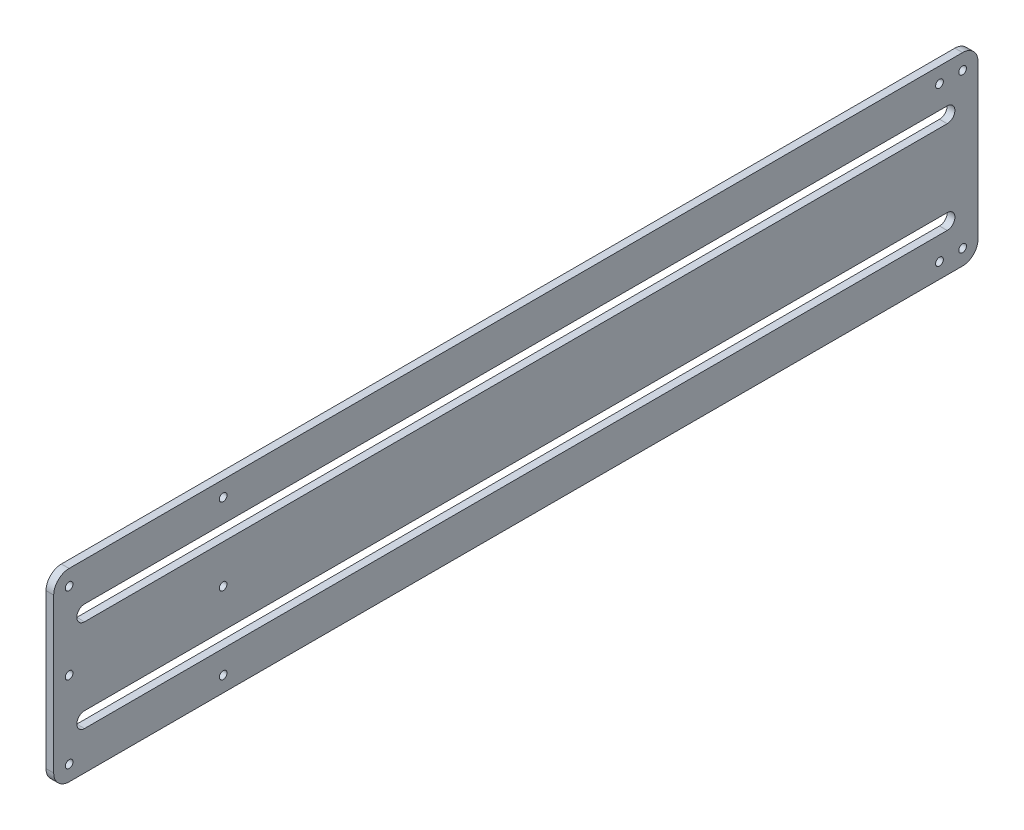
from build123d import *

# Parameters (mm, degrees)
OUTER_CUT_DEPTH    = 1.5875
SLOTS_DEPTH        = 195.298586266
SKETCH3_R          = 1.5875
MOUNT_HOLES_DEPTH  = 195.298586266
SKETCH4_R          = 1.5875
CUT_EXTRUDE1_DEPTH = 195.298586266


with BuildPart() as part:
    # Sketch1 → Outer Cut (new, symmetric)
    with BuildSketch(Plane(origin=(0, 0, 0), x_dir=(0, 0, -1), z_dir=(1, 0, 0))):
        with BuildLine():
            Line((-184.15, -38.1), (184.15, -38.1))
            ThreePointArc((184.15, -38.1), (188.640128061, -36.240128061), (190.5, -31.75))
            Line((190.5, -31.75), (190.5, 31.75))
            ThreePointArc((190.5, 31.75), (188.640128061, 36.240128061), (184.15, 38.1))
            Line((184.15, 38.1), (-184.15, 38.1))
            ThreePointArc((-184.15, 38.1), (-188.640128061, 36.240128061), (-190.5, 31.75))
            Line((-190.5, 31.75), (-190.5, -31.75))
            ThreePointArc((-190.5, -31.75), (-188.640128061, -36.240128061), (-184.15, -38.1))
        make_face()
    extrude(amount=OUTER_CUT_DEPTH, both=True)

    # Sketch2 → Slots (cut, through all)
    with BuildSketch(Plane(origin=(1.5875, 0, 0), x_dir=(0, 0, -1), z_dir=(1, 0, 0))):
        with BuildLine():
            Line((-177.8, 22.225), (177.8, 22.225))
            ThreePointArc((177.8, 22.225), (180.975, 19.05), (177.8, 15.875))
            Line((177.8, 15.875), (-177.8, 15.875))
            ThreePointArc((-177.8, 15.875), (-180.975, 19.05), (-177.8, 22.225))
        make_face()
        with BuildLine():
            Line((-177.8, -22.225), (177.8, -22.225))
            ThreePointArc((177.8, -22.225), (180.975, -19.05), (177.8, -15.875))
            Line((177.8, -15.875), (-177.8, -15.875))
            ThreePointArc((-177.8, -15.875), (-180.975, -19.05), (-177.8, -22.225))
        make_face()
    extrude(amount=-SLOTS_DEPTH, mode=Mode.SUBTRACT)

    # Sketch3 → Mount Holes (cut, through all)
    with BuildSketch(Plane(origin=(1.5875, 0, 0), x_dir=(0, 0, -1), z_dir=(1, 0, 0))):
        with Locations((-184.15, 31.75)):
            Circle(SKETCH3_R)
        with Locations((-120.65, 31.75)):
            Circle(SKETCH3_R)
        with Locations((-120.65, -31.75)):
            Circle(SKETCH3_R)
        with Locations((-184.15, -31.75)):
            Circle(SKETCH3_R)
        with Locations((-184.15, 0)):
            Circle(SKETCH3_R)
        with Locations((-120.65, 0)):
            Circle(SKETCH3_R)
    extrude(amount=-MOUNT_HOLES_DEPTH, mode=Mode.SUBTRACT)

    # Sketch4 → Cut-Extrude1 (cut, through all)
    with BuildSketch(Plane(origin=(1.5875, 0, 0), x_dir=(0, 0, -1), z_dir=(1, 0, 0))):
        with Locations((184.15, 31.75)):
            Circle(SKETCH4_R)
        with Locations((174.625, 31.75)):
            Circle(SKETCH4_R)
        with Locations((174.625, -31.75)):
            Circle(SKETCH4_R)
        with Locations((184.15, -31.75)):
            Circle(SKETCH4_R)
    extrude(amount=-CUT_EXTRUDE1_DEPTH, mode=Mode.SUBTRACT)


solid = part.part
